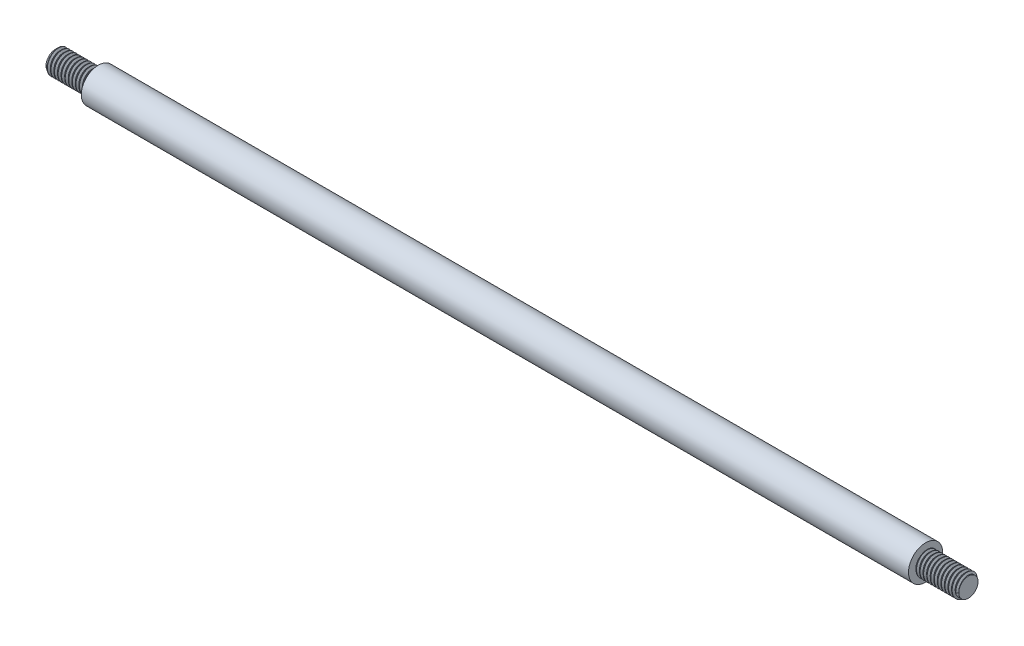
from build123d import *
from build123d.topology import SkipClean

# Parameters (mm, degrees)
THREAD_1_PITCH = 1.25
THREAD_2_PITCH = 1.25


with BuildPart() as part:
    # Sketch 1 → Повернуть1 (revolve)
    with BuildSketch(Plane.XY):
        Polygon((-145, 6), (145, 6), (145, 3.375), (160, 3.375), (160, 0), (-160, 0), (-160, 3.375), (-145, 3.375), align=None)
    revolve(axis=Axis((160, 0, 0), (-1, 0, 0)))

    # Резьба1: the profile of Sketch 1 2 profile screwed along a right-hand helix of 12 turns, 8 arcs to a turn; built about Z, then put on its axis
    with SkipClean():  # the faces are left unmerged after this step: merging them gives an invalid solid
        thread_1_z = Axis((0, 0, 0), (0, 0, 1))
        thread_1_corners = [(3.3747, 0, -0.000173205), (4.051582344, 0, 0.390624998), (4.051582344, 0, 0.546874998), (3.3747, 0, 0.937673202)]
        with BuildLine(mode=Mode.PRIVATE) as thread_1_profile:
            Line(thread_1_corners[0], thread_1_corners[1])
            Line(thread_1_corners[1], thread_1_corners[2])
            Line(thread_1_corners[2], thread_1_corners[3])
            Line(thread_1_corners[3], thread_1_corners[0])
        thread_1_cap = Face(thread_1_profile.wire())
        thread_1_turn_angles = [0, 22.5, 45, 67.5, 90, 112.5, 135, 157.5, 180, 202.5, 225, 247.5, 270, 292.5, 315, 337.5, 360]
        thread_1_turn_weights = [1, 0.9238795325112867, 1, 0.9238795325112867, 1, 0.9238795325112867, 1, 0.9238795325112867, 1, 0.9238795325112867, 1, 0.9238795325112867, 1, 0.9238795325112867, 1, 0.9238795325112867, 1]
        thread_1_turn_rails = [Edge.make_bspline([Vector(p[0], p[1], 0).rotate(thread_1_z, thread_1_turn_angles[k]) / thread_1_turn_weights[k] + Vector(0, 0, p[2] + THREAD_1_PITCH * thread_1_turn_angles[k] / 360) for k in range(17)], [0, 0, 0, 1, 1, 2, 2, 3, 3, 4, 4, 5, 5, 6, 6, 7, 7, 8, 8, 8], 2, thread_1_turn_weights) for p in thread_1_corners]
        thread_1_turn_sides = [Face.make_surface_from_curves(thread_1_turn_rails[p[0]], thread_1_turn_rails[p[1]]) for p in [(0, 1), (1, 2), (2, 3), (3, 0)]]
        thread_1 = Plane(origin=(-160, 0, 0), x_dir=(0, 0, -1), z_dir=(1, 0, 0)) * Solid(Shell([*[p.moved(Location((0, 0, THREAD_1_PITCH * i))) for i in range(12) for p in thread_1_turn_sides], thread_1_cap, thread_1_cap.rotate(thread_1_z, 4320).moved(Location((0, 0, THREAD_1_PITCH * 4320 / 360)))]))
        add(thread_1)

    # Резьба2: the profile of Профиль резьбы2 profile screwed along a right-hand helix of 12 turns, 8 arcs to a turn; built about Z, then put on its axis
    with SkipClean():  # the faces are left unmerged after this step: merging them gives an invalid solid
        thread_2_z = Axis((0, 0, 0), (0, 0, 1))
        thread_2_corners = [(3.3747, 0, -0.000173205), (4.051582344, 0, 0.390624998), (4.051582344, 0, 0.546874998), (3.3747, 0, 0.937673202)]
        with BuildLine(mode=Mode.PRIVATE) as thread_2_profile:
            Line(thread_2_corners[0], thread_2_corners[1])
            Line(thread_2_corners[1], thread_2_corners[2])
            Line(thread_2_corners[2], thread_2_corners[3])
            Line(thread_2_corners[3], thread_2_corners[0])
        thread_2_cap = Face(thread_2_profile.wire())
        thread_2_turn_angles = [0, 22.5, 45, 67.5, 90, 112.5, 135, 157.5, 180, 202.5, 225, 247.5, 270, 292.5, 315, 337.5, 360]
        thread_2_turn_weights = [1, 0.9238795325112867, 1, 0.9238795325112867, 1, 0.9238795325112867, 1, 0.9238795325112867, 1, 0.9238795325112867, 1, 0.9238795325112867, 1, 0.9238795325112867, 1, 0.9238795325112867, 1]
        thread_2_turn_rails = [Edge.make_bspline([Vector(p[0], p[1], 0).rotate(thread_2_z, thread_2_turn_angles[k]) / thread_2_turn_weights[k] + Vector(0, 0, p[2] + THREAD_2_PITCH * thread_2_turn_angles[k] / 360) for k in range(17)], [0, 0, 0, 1, 1, 2, 2, 3, 3, 4, 4, 5, 5, 6, 6, 7, 7, 8, 8, 8], 2, thread_2_turn_weights) for p in thread_2_corners]
        thread_2_turn_sides = [Face.make_surface_from_curves(thread_2_turn_rails[p[0]], thread_2_turn_rails[p[1]]) for p in [(0, 1), (1, 2), (2, 3), (3, 0)]]
        thread_2 = Plane(origin=(160, 0, 0), x_dir=(0, 0, 1), z_dir=(-1, 0, 0)) * Solid(Shell([*[p.moved(Location((0, 0, THREAD_2_PITCH * i))) for i in range(12) for p in thread_2_turn_sides], thread_2_cap, thread_2_cap.rotate(thread_2_z, 4320).moved(Location((0, 0, THREAD_2_PITCH * 4320 / 360)))]))
        add(thread_2)


solid = part.part
